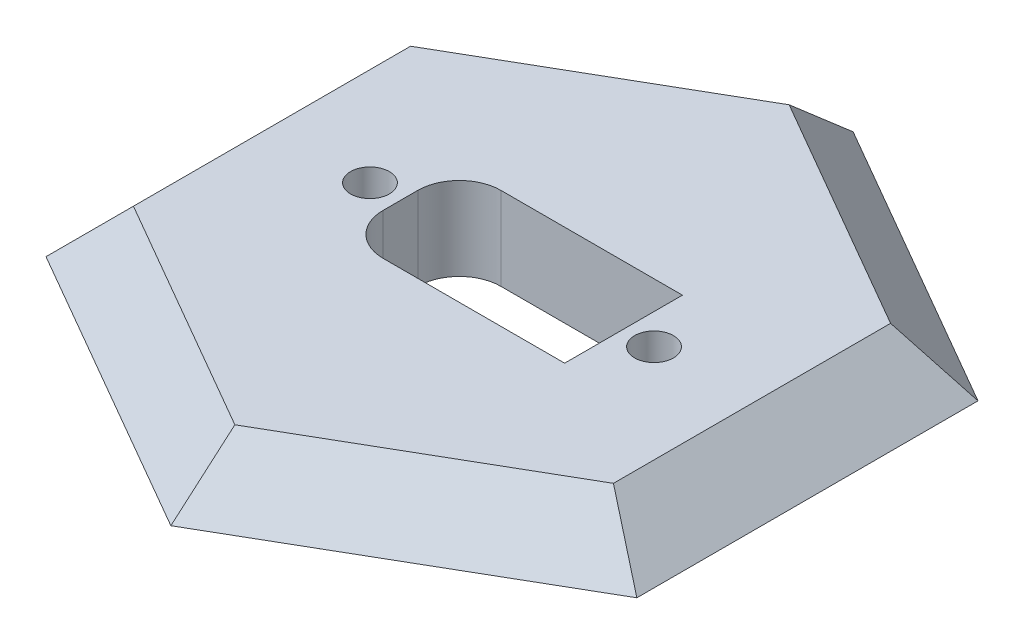
from build123d import *

# Parameters (mm, degrees)
SKETCH1_R           = 26
BOSS_EXTRUDE1_DEPTH = 4
SKETCH3_R           = 17
BOSS_EXTRUDE2_DEPTH = 2
CUT_EXTRUDE1_DEPTH  = 20
SKETCH4_R           = 1.4
CUT_EXTRUDE2_DEPTH  = 10
SKETCH6_OUTSIDE_W   = 88.756
SKETCH6_OUTSIDE_H   = 88.756
CUT_EXTRUDE3_DEPTH  = 10
CUT_EXTRUDE3_DRAFT  = -45


with BuildPart() as part:
    # Sketch1 → Boss-Extrude1 (new body)
    with BuildSketch(Plane(origin=(0, 0, 0), x_dir=(1, 0, 0), z_dir=(0, 1, 0))):
        Circle(SKETCH1_R)
    extrude(amount=BOSS_EXTRUDE1_DEPTH)

    # Sketch3 → Boss-Extrude2 (add)
    with BuildSketch(Plane.XZ):
        Circle(SKETCH3_R)
    extrude(amount=BOSS_EXTRUDE2_DEPTH)

    # Sketch2 → Cut-Extrude1 (cut)
    with BuildSketch(Plane(origin=(0, 4, 0), x_dir=(1, 0, 0), z_dir=(0, 1, 0))):
        with BuildLine():
            Line((-5.05, -4.25), (8.05, -4.25))
            Line((8.05, -4.25), (8.05, 4.25))
            Line((8.05, 4.25), (-5.05, 4.25))
            ThreePointArc((-5.05, 4.25), (-7.171320344, 3.371320344), (-8.05, 1.25))
            Line((-8.05, 1.25), (-8.05, -1.25))
            ThreePointArc((-8.05, -1.25), (-7.171320344, -3.371320344), (-5.05, -4.25))
        make_face()
    extrude(amount=-CUT_EXTRUDE1_DEPTH, mode=Mode.SUBTRACT)

    # Sketch4 → Cut-Extrude2 (cut)
    with BuildSketch(Plane(origin=(0, 4, 0), x_dir=(1, 0, 0), z_dir=(0, 1, 0))):
        with Locations((-10.25, 0)):
            Circle(SKETCH4_R)
        with Locations((10.25, 0)):
            Circle(SKETCH4_R)
    extrude(amount=-CUT_EXTRUDE2_DEPTH, mode=Mode.SUBTRACT)


with BuildPart() as cut_extrude3_tool:
    # Sketch6 outside → Cut-Extrude3 (with draft: the straight prism first)
    with BuildSketch(Plane(origin=(0, 4, 0), x_dir=(1, 0, 0), z_dir=(0, 1, 0))):
        Rectangle(SKETCH6_OUTSIDE_W, SKETCH6_OUTSIDE_H)
        Polygon((0, 20), (-17.320508076, 10), (-17.320508076, -10), (0, -20), (17.320508076, -10), (17.320508076, 10), align=None, mode=Mode.SUBTRACT)
    extrude(amount=-CUT_EXTRUDE3_DEPTH)
    # Cut-Extrude3: the draft: its side faces are tilted about the plane it starts from
    cut_extrude3_sides = [cut_extrude3_tool.faces().sort_by_distance(p)[0] for p in [
        (0, -1, 44.378),
        (44.378, -1, 0),
        (0, -1, -44.378),
        (-44.378, -1, 0),
        (8.660254038, -1, -15),
        (17.320508076, -1, 0),
        (8.660254038, -1, 15),
        (-8.660254038, -1, 15),
        (-17.320508076, -1, 0),
        (-8.660254038, -1, -15),
    ]]
    draft(cut_extrude3_sides, Plane(origin=(0, 4, 0), x_dir=(1, 0, 0), z_dir=(0, 1, 0)), CUT_EXTRUDE3_DRAFT)


with BuildPart() as part_1:
    add(part.part)

    # Cut-Extrude3: cut by cut_extrude3_tool
    add(cut_extrude3_tool.part, mode=Mode.SUBTRACT)


solid = part_1.part
